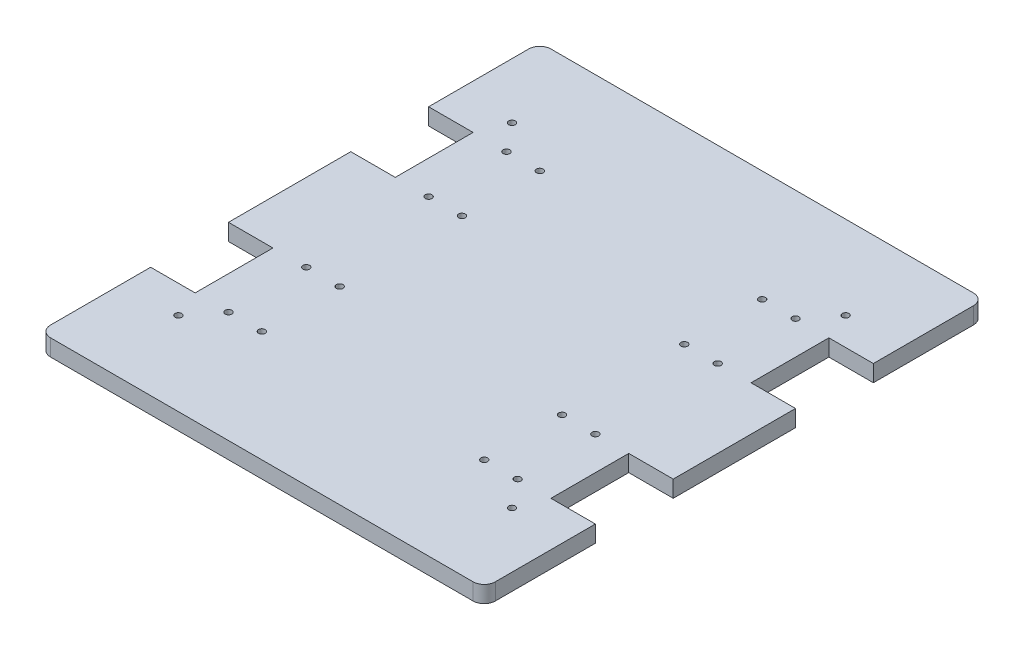
from build123d import *

# Parameters (mm, degrees)
EXTRUDE_1_DEPTH     = 15
SKETCH_3_R          = 3
CUT_EXTRUDE_1_DEPTH = 15


with BuildPart() as part:
    # 草圖1 → 填料-伸長1 (new body)
    with BuildSketch(Plane(origin=(0, 0, 0), x_dir=(1, 0, 0), z_dir=(0, 1, 0))):
        with BuildLine():
            Line((-200, 55), (-200, -55))
            Line((-200, -55), (-160, -55))
            Line((-160, -55), (-160, -125))
            Line((-160, -125), (-200, -125))
            Line((-200, -125), (-200, -215))
            ThreePointArc((-200, -215), (-197.071067812, -222.071067812), (-190, -225))
            Line((-190, -225), (190, -225))
            ThreePointArc((190, -225), (197.071067812, -222.071067812), (200, -215))
            Line((200, -215), (200, -125))
            Line((200, -125), (160, -125))
            Line((160, -125), (160, -55))
            Line((160, -55), (200, -55))
            Line((200, -55), (200, 55))
            Line((200, 55), (160, 55))
            Line((160, 55), (160, 125))
            Line((160, 125), (200, 125))
            Line((200, 125), (200, 215))
            ThreePointArc((200, 215), (197.071067812, 222.071067812), (190, 225))
            Line((190, 225), (-190, 225))
            ThreePointArc((-190, 225), (-197.071067812, 222.071067812), (-200, 215))
            Line((-200, 215), (-200, 125))
            Line((-200, 125), (-160, 125))
            Line((-160, 125), (-160, 55))
            Line((-160, 55), (-200, 55))
        make_face()
    extrude(amount=EXTRUDE_1_DEPTH)

    # 草圖3 → 除料-伸長1 (cut)
    with BuildSketch(Plane(origin=(0, 15, 0), x_dir=(1, 0, 0), z_dir=(0, 1, 0))):
        with Locations((-130, 125)):
            Circle(SKETCH_3_R)
        with Locations((-100, 125)):
            Circle(SKETCH_3_R)
        with Locations((-100, 55)):
            Circle(SKETCH_3_R)
        with Locations((-130, 55)):
            Circle(SKETCH_3_R)
        with Locations((100, 55)):
            Circle(SKETCH_3_R)
        with Locations((130, 55)):
            Circle(SKETCH_3_R)
        with Locations((100, 125)):
            Circle(SKETCH_3_R)
        with Locations((130, 125)):
            Circle(SKETCH_3_R)
        with Locations((100, -125)):
            Circle(SKETCH_3_R)
        with Locations((130, -125)):
            Circle(SKETCH_3_R)
        with Locations((130, -55)):
            Circle(SKETCH_3_R)
        with Locations((100, -55)):
            Circle(SKETCH_3_R)
        with Locations((-100, -55)):
            Circle(SKETCH_3_R)
        with Locations((-130, -55)):
            Circle(SKETCH_3_R)
        with Locations((-100, -125)):
            Circle(SKETCH_3_R)
        with Locations((-130, -125)):
            Circle(SKETCH_3_R)
        with Locations((-150, -150)):
            Circle(SKETCH_3_R)
        with Locations((150, -150)):
            Circle(SKETCH_3_R)
        with Locations((150, 150)):
            Circle(SKETCH_3_R)
        with Locations((-150, 150)):
            Circle(SKETCH_3_R)
    extrude(amount=-CUT_EXTRUDE_1_DEPTH, mode=Mode.SUBTRACT)


solid = part.part
